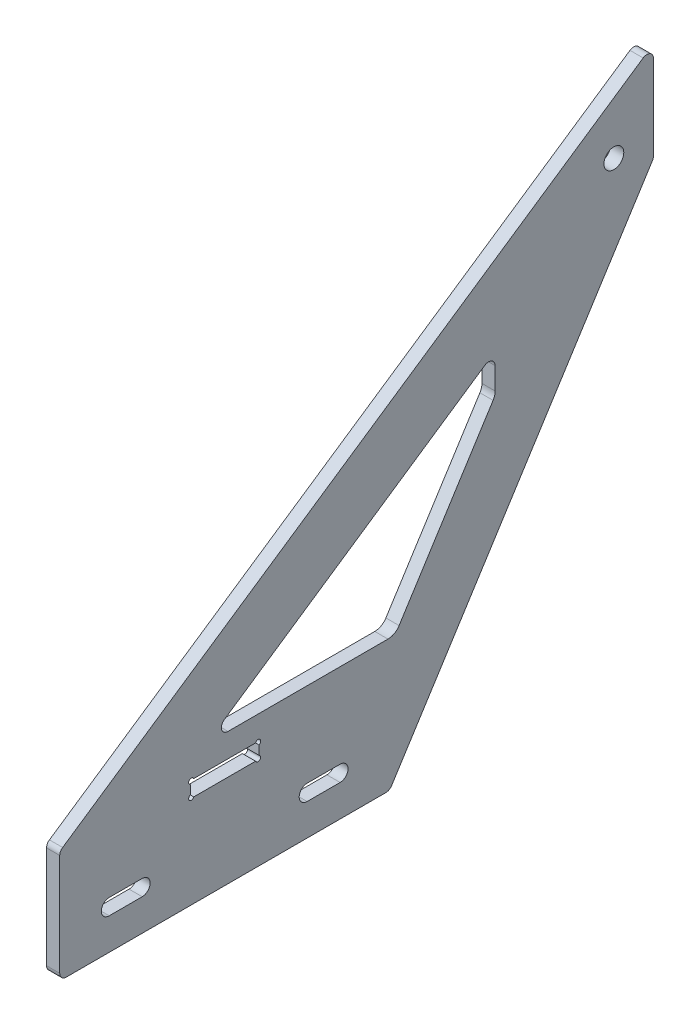
from build123d import *

# Parameters (mm, degrees)
BASE_FLANGE1_DEPTH = 10
CUT_EXTRUDE1_DEPTH = 464.357313528
CUT_EXTRUDE2_DEPTH = 464.357313528
FILLET1_R          = 10
FILLET2_R          = 5
SKETCH8_R          = 7.5
CUT_EXTRUDE3_DEPTH = 460.635608137
SKETCH9_W          = 52
SKETCH9_H          = 12
CUT_EXTRUDE4_DEPTH = 460.635608137
SKETCH10_R         = 2
CUT_EXTRUDE5_DEPTH = 460.635608137


# Sheet-metal steps are written as plain solids
with BuildPart() as part:
    # Sketch1 → Base-Flange1 (new body)
    with BuildSketch(Plane(origin=(0, 0, 0), x_dir=(0, 0, -1), z_dir=(1, 0, 0))):
        Polygon((0, 0), (200, 315), (200, 390), (-250, 85), (-250, 0), align=None)
    extrude(amount=-BASE_FLANGE1_DEPTH)

    # Sketch6 → Cut-Extrude1 (cut, through all)
    with BuildSketch(Plane(origin=(0, 0, 0), x_dir=(0, 0, -1), z_dir=(1, 0, 0))):
        with BuildLine():
            Line((-212.5, 36), (-187.5, 36))
            ThreePointArc((-187.5, 36), (-181.5, 30), (-187.5, 24))
            Line((-187.5, 24), (-212.5, 24))
            ThreePointArc((-212.5, 24), (-218.5, 30), (-212.5, 36))
        make_face()
        with BuildLine():
            Line((-37.5, 36), (-62.5, 36))
            ThreePointArc((-62.5, 36), (-68.5, 30), (-62.5, 24))
            Line((-62.5, 24), (-37.5, 24))
            ThreePointArc((-37.5, 24), (-31.5, 30), (-37.5, 36))
        make_face()
    extrude(amount=-CUT_EXTRUDE1_DEPTH, mode=Mode.SUBTRACT)

    # Sketch7 → Cut-Extrude2 (cut, through all)
    with BuildSketch(Plane(origin=(0, 0, 0), x_dir=(0, 0, -1), z_dir=(1, 0, 0))):
        Polygon((80, 248.264209845), (-138.750473541, 100), (4.265291407, 100), (80, 219.282166034), align=None)
    extrude(amount=-CUT_EXTRUDE2_DEPTH, mode=Mode.SUBTRACT)

    # Fillet1
    fillet1_edges = [part.edges().sort_by_distance(p)[0] for p in [
        (-5, 219.282166034, -80),
        (-5, 100, -4.265291407),
    ]]
    fillet(fillet1_edges, radius=FILLET1_R)

    # Fillet2
    fillet2_edges = [part.edges().sort_by_distance(p)[0] for p in [
        (-5, 248.264209845, -80),
        (-5, 100, 138.750473541),
        (-5, 0, 250),
        (-5, 85, 250),
        (-5, 390, -200),
        (-5, 315, -200),
        (-5, 0, 0),
    ]]
    fillet(fillet2_edges, radius=FILLET2_R)

    # Sketch8 → Cut-Extrude3 (cut, through all)
    with BuildSketch(Plane(origin=(0, 0, 0), x_dir=(0, 0, -1), z_dir=(1, 0, 0))):
        with Locations((170, 330)):
            Circle(SKETCH8_R)
    extrude(amount=-CUT_EXTRUDE3_DEPTH, mode=Mode.SUBTRACT)

    # Sketch9 → Cut-Extrude4 (cut, through all)
    with BuildSketch(Plane(origin=(0, 0, 0), x_dir=(0, 0, -1), z_dir=(1, 0, 0))):
        with Locations((-125, 76)):
            Rectangle(SKETCH9_W, SKETCH9_H)
    extrude(amount=-CUT_EXTRUDE4_DEPTH, mode=Mode.SUBTRACT)

    # Sketch10 → Cut-Extrude5 (cut, through all)
    with BuildSketch(Plane(origin=(0, 0, 0), x_dir=(0, 0, -1), z_dir=(1, 0, 0))):
        with Locations((-150.292893219, 70.707106781)):
            Circle(SKETCH10_R)
        with Locations((-150.292893219, 81.292893219)):
            Circle(SKETCH10_R)
        with Locations((-99.707106781, 81.292893219)):
            Circle(SKETCH10_R)
        with Locations((-99.707106781, 70.707106781)):
            Circle(SKETCH10_R)
    extrude(amount=-CUT_EXTRUDE5_DEPTH, mode=Mode.SUBTRACT)


solid = part.part
